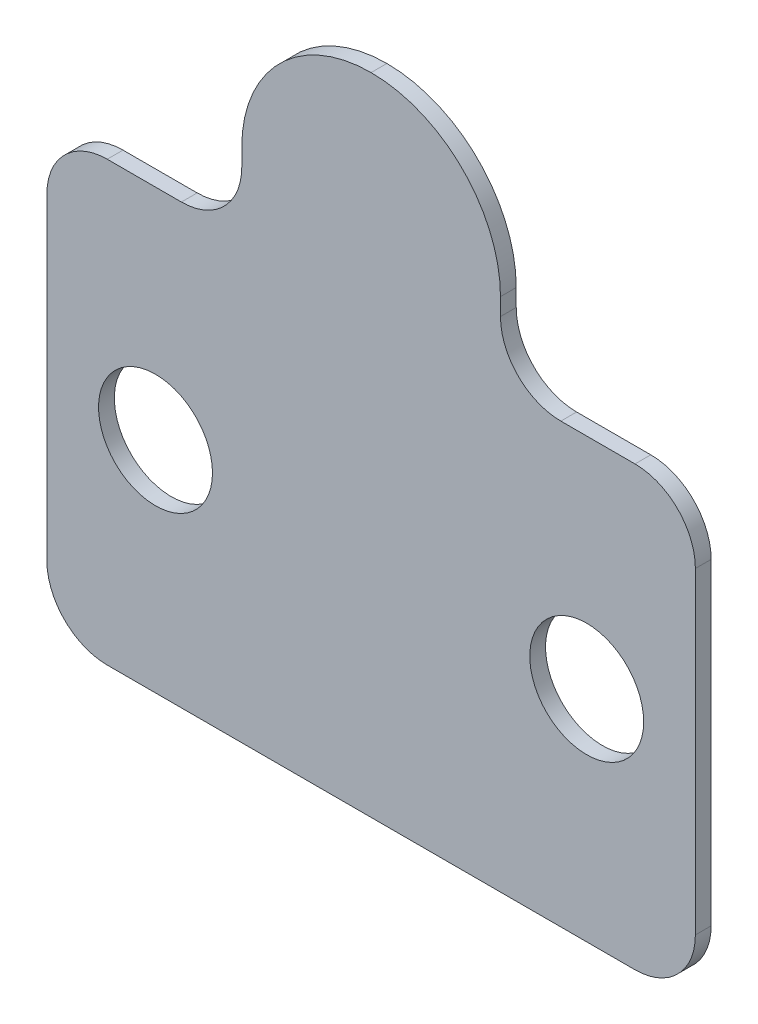
from build123d import *
from OCP.BRepFilletAPI import BRepFilletAPI_MakeFillet

# Parameters (mm, degrees)
SKETCH1_R           = 3.302
SKETCH1_R_2         = 4.5
BOSS_EXTRUDE1_DEPTH = 0.9144
FILLET2_R           = 7.5
FILLET2_R_2         = 3.5


with BuildPart() as part:
    # Sketch1 → Boss-Extrude1 (new body)
    # profile 1 of 2: a face of its own
    with BuildSketch(Plane.XY):
        Polygon((26.3, 25.4), (37.6, 25.4), (37.6, 0), (0, 0), (0, 25.4), (11.3, 25.4), (11.3, 37.4), (26.3, 37.4), align=None)
        with Locations((31.3, 12.7)):
            Circle(SKETCH1_R, mode=Mode.SUBTRACT)
        with Locations((6.3, 12.7)):
            Circle(SKETCH1_R, mode=Mode.SUBTRACT)
        with Locations((18.8, 29.9)):
            Circle(SKETCH1_R_2, mode=Mode.SUBTRACT)
    # profile 2 of 2: a face of its own
    with BuildSketch(Plane.XY):
        with Locations((18.8, 29.9)):
            Circle(SKETCH1_R_2)
    extrude(amount=BOSS_EXTRUDE1_DEPTH)

    # Fillet2
    fillet2_edges_1 = [part.edges().sort_by_distance(p)[0] for p in [
        (11.3, 37.4, 0.4572),
        (26.3, 37.4, 0.4572),
    ]]
    fillet2_edges_2 = [part.edges().sort_by_distance(p)[0] for p in [
        (11.3, 25.4, 0.4572),
        (0, 25.4, 0.4572),
        (0, 0, 0.4572),
        (37.6, 25.4, 0.4572),
        (26.3, 25.4, 0.4572),
        (37.6, 0, 0.4572),
    ]]
    fillet2 = BRepFilletAPI_MakeFillet(part.part.solid().wrapped)
    for e in fillet2_edges_1:
        fillet2.Add(FILLET2_R - 0.0001, e.wrapped)
    for e in fillet2_edges_2:
        fillet2.Add(FILLET2_R_2 - 0.0001, e.wrapped)
    add(Compound.cast(fillet2.Shape()), mode=Mode.REPLACE)  # a hair under: the kernel refuses the full size


solid = part.part
